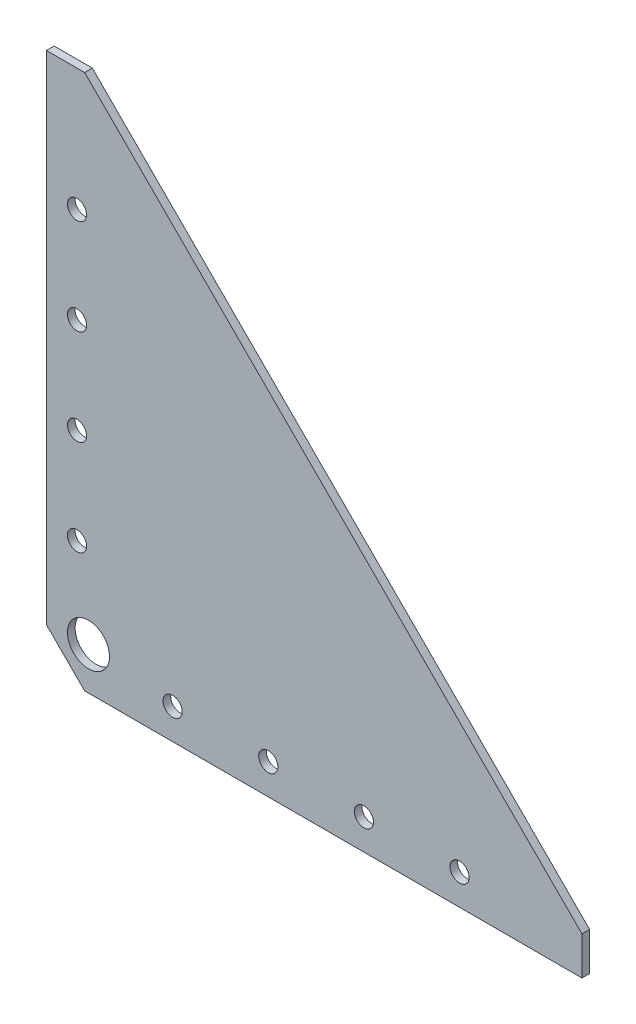
from build123d import *

# Parameters (mm, degrees)
SM_BASE_FLANGE_1_DEPTH = 2
SKETCH_7_R             = 5.5
SKETCH_7_R_2           = 2.5
CUT_EXTRUDE_1_DEPTH    = 10


# Sheet-metal steps are written as plain solids
with BuildPart() as part:
    # Sketch 1 → Базовая кромка1 (new body)
    with BuildSketch(Plane.XY):
        Polygon((0, 0), (140, 0), (140, 10), (10, 140), (0, 140), align=None)
    extrude(amount=-SM_BASE_FLANGE_1_DEPTH)

    # Эскиз7 → Вырез-Вытянуть1 (cut)
    with BuildSketch(Plane.XY):
        Polygon((10, 0), (0, 10), (0, 0), align=None)
        with Locations((11, 11)):
            Circle(SKETCH_7_R)
        with Locations((8, 33)):
            Circle(SKETCH_7_R_2)
        with Locations((33, 8)):
            Circle(SKETCH_7_R_2)
        with Locations((58, 8)):
            Circle(SKETCH_7_R_2)
        with Locations((83, 8)):
            Circle(SKETCH_7_R_2)
        with Locations((8, 58)):
            Circle(SKETCH_7_R_2)
        with Locations((8, 108)):
            Circle(SKETCH_7_R_2)
        with Locations((8, 83)):
            Circle(SKETCH_7_R_2)
        with Locations((108, 8)):
            Circle(SKETCH_7_R_2)
    extrude(amount=-CUT_EXTRUDE_1_DEPTH, mode=Mode.SUBTRACT)


solid = part.part
